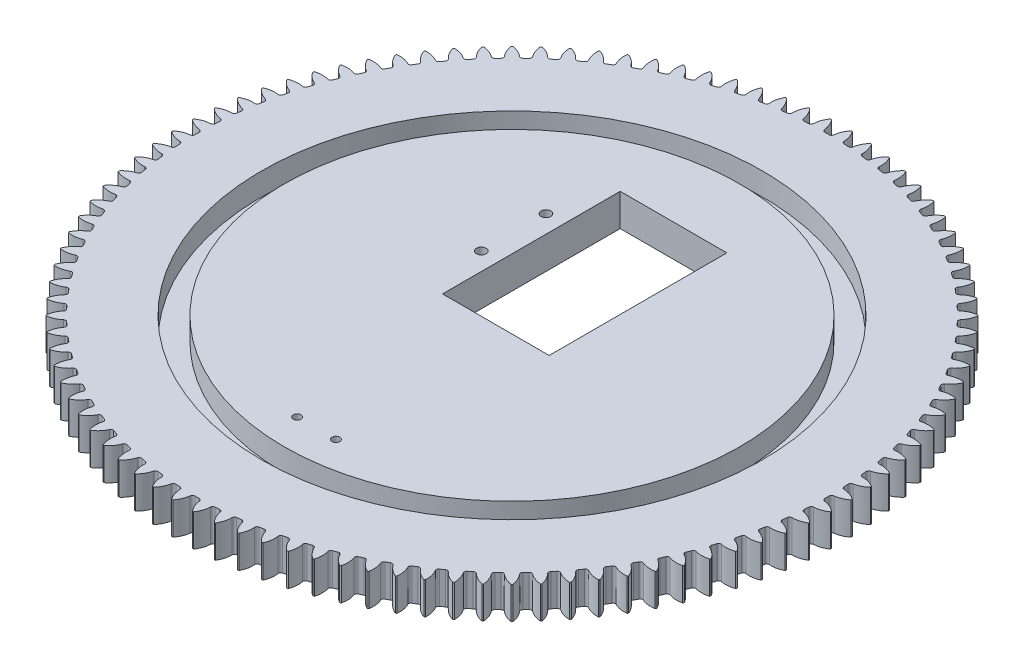
from build123d import *

# Parameters (mm, degrees)
SKETCH1_R                = 102
BOSS_EXTRUDE1_DEPTH      = 10
CUT_EXTRUDE1_DEPTH       = 145.595988879
FILLET1_R                = 0.76
CIRPATTERN2_COUNT        = 100
FILLET1_OF_CIRPATTERN2_R = 0.76
SKETCH3_R                = 77.5
SKETCH3_R_2              = 70.5
CUT_EXTRUDE2_DEPTH       = 7
SKETCH6_W                = 33
SKETCH6_H                = 55
CUT_EXTRUDE3_DEPTH       = 145.533117456
SKETCH7_W                = 42
SKETCH7_H                = 47
SKETCH7_R                = 12
SKETCH7_R_2              = 1.65
BOSS_EXTRUDE2_DEPTH      = 5
SKETCH9_W                = 42
SKETCH9_H                = 42
BOSS_EXTRUDE3_DEPTH      = 5
SKETCH10_R               = 1.2
CUT_EXTRUDE4_DEPTH       = 152.65362521
SKETCH11_R               = 1.5
CUT_EXTRUDE5_DEPTH       = 152.65362521


with BuildPart() as part:
    # Sketch1 → Boss-Extrude1 (new body)
    with BuildSketch(Plane(origin=(0, 0, 0), x_dir=(1, 0, 0), z_dir=(0, 1, 0))):
        Circle(SKETCH1_R)
    extrude(amount=BOSS_EXTRUDE1_DEPTH)

    # Sketch2 → Cut-Extrude1 (cut, through all)
    with BuildSketch(Plane(origin=(0, 10, 0), x_dir=(1, 0, 0), z_dir=(0, 1, 0))):
        with BuildLine():
            ThreePointArc((1.389546622, 97.490097755), (0, 97.5), (-1.389546622, 97.490097755))
            ThreePointArc((-1.389546622, 97.490097755), (-1.824876583, 99.860091271), (-3.014796953, 101.95543634))
            ThreePointArc((-3.014796953, 101.95543634), (0, 102), (3.014796953, 101.95543634))
            ThreePointArc((3.014796953, 101.95543634), (1.824876583, 99.860091271), (1.389546622, 97.490097755))
        make_face()
    cut_extrude1 = extrude(amount=-CUT_EXTRUDE1_DEPTH, mode=Mode.SUBTRACT)

    # Fillet1
    fillet1_edges = [part.edges().sort_by_distance(p)[0] for p in [
        (1.389546622, 5, -97.490097755),
        (-1.389546622, 5, -97.490097755),
    ]]
    fillet(fillet1_edges, radius=FILLET1_R)

    # CirPattern2: Cut-Extrude1 ×100 about axis
    cirpattern2_axis = Axis((0, 10, 0), (0, 1, 0))
    for i in range(1, CIRPATTERN2_COUNT):
        add(cut_extrude1.rotate(cirpattern2_axis, i * 360 / CIRPATTERN2_COUNT), mode=Mode.SUBTRACT)

    # Fillet1 of CirPattern2
    fillet1_of_cirpattern2_edges = [part.edges().sort_by_distance(p)[0] for p in [
        (-4.734649218, 5, -97.38497367),
        (-7.508258556, 5, -97.210472962),
        (-10.840159561, 5, -96.895515586),
        (-13.597338824, 5, -96.547202844),
        (-16.902888746, 5, -96.023655169),
        (-19.632756607, 5, -95.502905024),
        (-22.898909951, 5, -94.772833254),
        (-25.59069287, 5, -94.081700869),
        (-28.80455962, 5, -93.147986264),
        (-31.447634359, 5, -92.289199223),
        (-34.596530852, 5, -91.155526728),
        (-37.180466402, 5, -90.132474271),
        (-40.251965383, 5, -88.803317972),
        (-42.766564131, 5, -87.62003762),
        (-45.748543795, 5, -86.100643091),
        (-48.183881769, 5, -84.76180471),
        (-51.064573605, 5, -83.058168307),
        (-53.411039638, 5, -81.569055681),
        (-56.179074873, 5, -79.687900878),
        (-58.427408536, 5, -78.054390855),
        (-61.071862998, 5, -76.003141711),
        (-63.213191145, 5, -74.231681008),
        (-65.723628381, 5, -72.018432866),
        (-67.749500168, 5, -70.116012629),
        (-70.116012629, 5, -67.749500168),
        (-72.018432866, 5, -65.723628381),
        (-74.231681008, 5, -63.213191145),
        (-76.003141711, 5, -61.071862998),
        (-78.054390855, 5, -58.427408536),
        (-79.687900878, 5, -56.179074873),
        (-81.569055681, 5, -53.411039638),
        (-83.058168307, 5, -51.064573605),
        (-84.76180471, 5, -48.183881769),
        (-86.100643091, 5, -45.748543795),
        (-87.62003762, 5, -42.766564131),
        (-88.803317972, 5, -40.251965383),
        (-90.132474271, 5, -37.180466402),
        (-91.155526728, 5, -34.596530852),
        (-92.289199223, 5, -31.447634359),
        (-93.147986264, 5, -28.80455962),
        (-94.081700869, 5, -25.59069287),
        (-94.772833254, 5, -22.898909951),
        (-95.502905024, 5, -19.632756607),
        (-96.023655169, 5, -16.902888746),
        (-96.547202844, 5, -13.597338824),
        (-96.895515586, 5, -10.840159561),
        (-97.210472962, 5, -7.508258556),
        (-97.38497367, 5, -4.734649218),
        (-97.490097755, 5, -1.389546622),
        (-97.490097755, 5, 1.389546622),
        (-97.38497367, 5, 4.734649218),
        (-97.210472962, 5, 7.508258556),
        (-96.895515586, 5, 10.840159561),
        (-96.547202844, 5, 13.597338824),
        (-96.023655169, 5, 16.902888746),
        (-95.502905024, 5, 19.632756607),
        (-94.772833254, 5, 22.898909951),
        (-94.081700869, 5, 25.59069287),
        (-93.147986264, 5, 28.80455962),
        (-92.289199223, 5, 31.447634359),
        (-91.155526728, 5, 34.596530852),
        (-90.132474271, 5, 37.180466402),
        (-88.803317972, 5, 40.251965383),
        (-87.62003762, 5, 42.766564131),
        (-86.100643091, 5, 45.748543795),
        (-84.76180471, 5, 48.183881769),
        (-83.058168307, 5, 51.064573605),
        (-81.569055681, 5, 53.411039638),
        (-79.687900878, 5, 56.179074873),
        (-78.054390855, 5, 58.427408536),
        (-76.003141711, 5, 61.071862998),
        (-74.231681008, 5, 63.213191145),
        (-72.018432866, 5, 65.723628381),
        (-70.116012629, 5, 67.749500168),
        (-67.749500168, 5, 70.116012629),
        (-65.723628381, 5, 72.018432866),
        (-63.213191145, 5, 74.231681008),
        (-61.071862998, 5, 76.003141711),
        (-58.427408536, 5, 78.054390855),
        (-56.179074873, 5, 79.687900878),
        (-53.411039638, 5, 81.569055681),
        (-51.064573605, 5, 83.058168307),
        (-48.183881769, 5, 84.76180471),
        (-45.748543795, 5, 86.100643091),
        (-42.766564131, 5, 87.62003762),
        (-40.251965383, 5, 88.803317972),
        (-37.180466402, 5, 90.132474271),
        (-34.596530852, 5, 91.155526728),
        (-31.447634359, 5, 92.289199223),
        (-28.80455962, 5, 93.147986264),
        (-25.59069287, 5, 94.081700869),
        (-22.898909951, 5, 94.772833254),
        (-19.632756607, 5, 95.502905024),
        (-16.902888746, 5, 96.023655169),
        (-13.597338824, 5, 96.547202844),
        (-10.840159561, 5, 96.895515586),
        (-7.508258556, 5, 97.210472962),
        (-4.734649218, 5, 97.38497367),
        (-1.389546622, 5, 97.490097755),
        (1.389546622, 5, 97.490097755),
        (4.734649218, 5, 97.38497367),
        (7.508258556, 5, 97.210472962),
        (10.840159561, 5, 96.895515586),
        (13.597338824, 5, 96.547202844),
        (16.902888746, 5, 96.023655169),
        (19.632756607, 5, 95.502905024),
        (22.898909951, 5, 94.772833254),
        (25.59069287, 5, 94.081700869),
        (28.80455962, 5, 93.147986264),
        (31.447634359, 5, 92.289199223),
        (34.596530852, 5, 91.155526728),
        (37.180466402, 5, 90.132474271),
        (40.251965383, 5, 88.803317972),
        (42.766564131, 5, 87.62003762),
        (45.748543795, 5, 86.100643091),
        (48.183881769, 5, 84.76180471),
        (51.064573605, 5, 83.058168307),
        (53.411039638, 5, 81.569055681),
        (56.179074873, 5, 79.687900878),
        (58.427408536, 5, 78.054390855),
        (61.071862998, 5, 76.003141711),
        (63.213191145, 5, 74.231681008),
        (65.723628381, 5, 72.018432866),
        (67.749500168, 5, 70.116012629),
        (70.116012629, 5, 67.749500168),
        (72.018432866, 5, 65.723628381),
        (74.231681008, 5, 63.213191145),
        (76.003141711, 5, 61.071862998),
        (78.054390855, 5, 58.427408536),
        (79.687900878, 5, 56.179074873),
        (81.569055681, 5, 53.411039638),
        (83.058168307, 5, 51.064573605),
        (84.76180471, 5, 48.183881769),
        (86.100643091, 5, 45.748543795),
        (87.62003762, 5, 42.766564131),
        (88.803317972, 5, 40.251965383),
        (90.132474271, 5, 37.180466402),
        (91.155526728, 5, 34.596530852),
        (92.289199223, 5, 31.447634359),
        (93.147986264, 5, 28.80455962),
        (94.081700869, 5, 25.59069287),
        (94.772833254, 5, 22.898909951),
        (95.502905024, 5, 19.632756607),
        (96.023655169, 5, 16.902888746),
        (96.547202844, 5, 13.597338824),
        (96.895515586, 5, 10.840159561),
        (97.210472962, 5, 7.508258556),
        (97.38497367, 5, 4.734649218),
        (97.490097755, 5, 1.389546622),
        (97.490097755, 5, -1.389546622),
        (97.38497367, 5, -4.734649218),
        (97.210472962, 5, -7.508258556),
        (96.895515586, 5, -10.840159561),
        (96.547202844, 5, -13.597338824),
        (96.023655169, 5, -16.902888746),
        (95.502905024, 5, -19.632756607),
        (94.772833254, 5, -22.898909951),
        (94.081700869, 5, -25.59069287),
        (93.147986264, 5, -28.80455962),
        (92.289199223, 5, -31.447634359),
        (91.155526728, 5, -34.596530852),
        (90.132474271, 5, -37.180466402),
        (88.803317972, 5, -40.251965383),
        (87.62003762, 5, -42.766564131),
        (86.100643091, 5, -45.748543795),
        (84.76180471, 5, -48.183881769),
        (83.058168307, 5, -51.064573605),
        (81.569055681, 5, -53.411039638),
        (79.687900878, 5, -56.179074873),
        (78.054390855, 5, -58.427408536),
        (76.003141711, 5, -61.071862998),
        (74.231681008, 5, -63.213191145),
        (72.018432866, 5, -65.723628381),
        (70.116012629, 5, -67.749500168),
        (67.749500168, 5, -70.116012629),
        (65.723628381, 5, -72.018432866),
        (63.213191145, 5, -74.231681008),
        (61.071862998, 5, -76.003141711),
        (58.427408536, 5, -78.054390855),
        (56.179074873, 5, -79.687900878),
        (53.411039638, 5, -81.569055681),
        (51.064573605, 5, -83.058168307),
        (48.183881769, 5, -84.76180471),
        (45.748543795, 5, -86.100643091),
        (42.766564131, 5, -87.62003762),
        (40.251965383, 5, -88.803317972),
        (37.180466402, 5, -90.132474271),
        (34.596530852, 5, -91.155526728),
        (31.447634359, 5, -92.289199223),
        (28.80455962, 5, -93.147986264),
        (25.59069287, 5, -94.081700869),
        (22.898909951, 5, -94.772833254),
        (19.632756607, 5, -95.502905024),
        (16.902888746, 5, -96.023655169),
        (13.597338824, 5, -96.547202844),
        (10.840159561, 5, -96.895515586),
        (7.508258556, 5, -97.210472962),
        (4.734649218, 5, -97.38497367),
    ]]
    fillet(fillet1_of_cirpattern2_edges, radius=FILLET1_OF_CIRPATTERN2_R)

    # Sketch3 → Cut-Extrude2 (cut)
    with BuildSketch(Plane(origin=(0, 10, 0), x_dir=(1, 0, 0), z_dir=(0, 1, 0))):
        Circle(SKETCH3_R)
        Circle(SKETCH3_R_2, mode=Mode.SUBTRACT)
    extrude(amount=-CUT_EXTRUDE2_DEPTH, mode=Mode.SUBTRACT)

    # Sketch6 → Cut-Extrude3 (cut, through all)
    with BuildSketch(Plane.XZ):
        with Locations((0, -22.5)):
            Rectangle(SKETCH6_W, SKETCH6_H)
    extrude(amount=-CUT_EXTRUDE3_DEPTH, mode=Mode.SUBTRACT)

    # Sketch7 → Boss-Extrude2 (add)
    with BuildSketch(Plane(origin=(21.5, 0, 0), x_dir=(0, 0, -1), z_dir=(1, 0, 0))):
        with Locations((22.5, -23.5)):
            Rectangle(SKETCH7_W, SKETCH7_H)
        with Locations((22.5, -26)):
            Circle(SKETCH7_R, mode=Mode.SUBTRACT)
        with Locations((7, -10.5)):
            Circle(SKETCH7_R_2, mode=Mode.SUBTRACT)
        with Locations((38, -10.5)):
            Circle(SKETCH7_R_2, mode=Mode.SUBTRACT)
        with Locations((38, -41.5)):
            Circle(SKETCH7_R_2, mode=Mode.SUBTRACT)
        with Locations((7, -41.5)):
            Circle(SKETCH7_R_2, mode=Mode.SUBTRACT)
    extrude(amount=BOSS_EXTRUDE2_DEPTH)

    # Sketch9 → Boss-Extrude3 (add)
    with BuildSketch(Plane.XZ):
        with Locations((47.5, -22.5)):
            Rectangle(SKETCH9_W, SKETCH9_H)
    extrude(amount=BOSS_EXTRUDE3_DEPTH)

    # Sketch10 → Cut-Extrude4 (cut, through all)
    with BuildSketch(Plane.XZ):
        with Locations((-6, 60.5)):
            Circle(SKETCH10_R)
        with Locations((6, 60.5)):
            Circle(SKETCH10_R)
    extrude(amount=-CUT_EXTRUDE4_DEPTH, mode=Mode.SUBTRACT)

    # Sketch11 → Cut-Extrude5 (cut, through all)
    with BuildSketch(Plane.XZ):
        with Locations((-22, -12.5)):
            Circle(SKETCH11_R)
        with Locations((-22, -32.5)):
            Circle(SKETCH11_R)
    extrude(amount=-CUT_EXTRUDE5_DEPTH, mode=Mode.SUBTRACT)


solid = part.part
